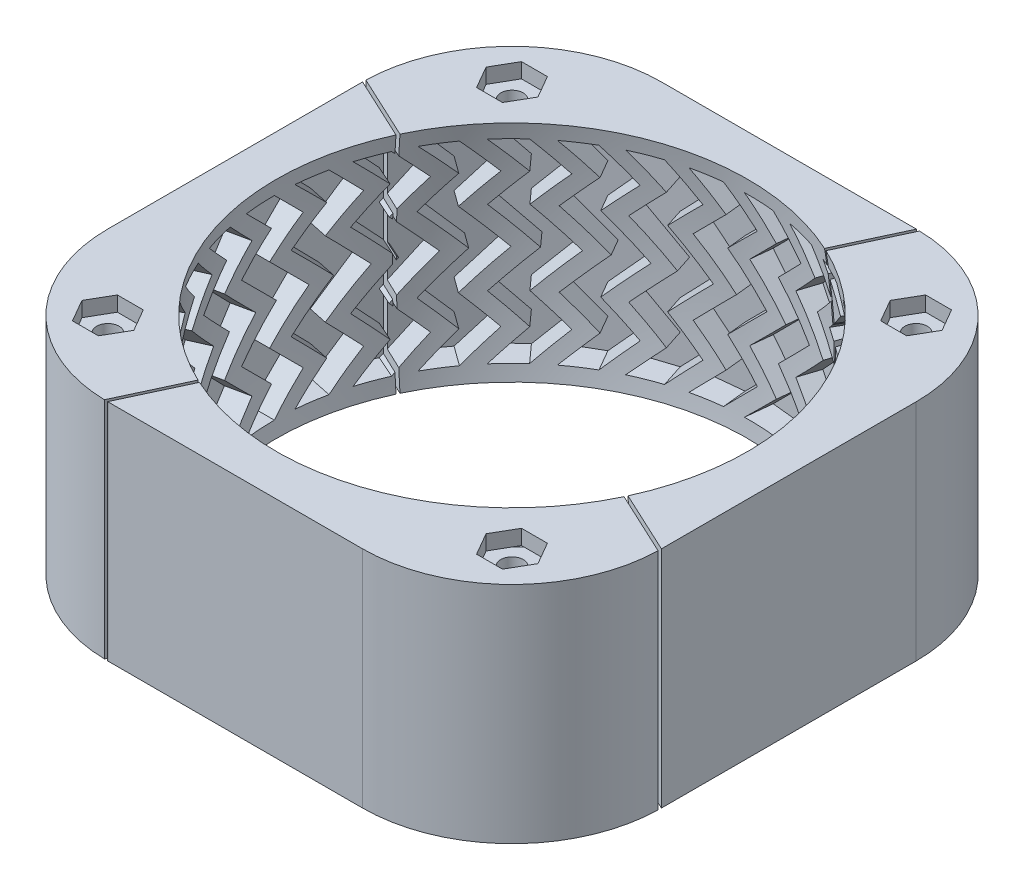
from build123d import *

# Parameters (mm, degrees)
SKETCH_2_W               = 74
SKETCH_2_H               = 74
EXTRUDE_1_DEPTH          = 30
SKETCH_3_W               = 31.5
SKETCH_3_H               = 30
FILLET_1_R               = 20
CUT_EXTRUDE_3_DEPTH      = 4
PATTERN_CIRCULAR_1_COUNT = 30
SKETCH_17_R              = 1.5
CUT_EXTRUDE_12_DEPTH     = 61.31583545
CUT_EXTRUDE_13_DEPTH     = 2
CUT_EXTRUDE_15_DEPTH     = 2
CUT_EXTRUDE_16_DEPTH     = 61.31583545


with BuildPart() as part:
    # Эскиз2 → Бобышка-Вытянуть1 (new body)
    with BuildSketch(Plane(origin=(0, 0, 0), x_dir=(1, 0, 0), z_dir=(0, 1, 0))):
        Rectangle(SKETCH_2_W, SKETCH_2_H)
    extrude(amount=EXTRUDE_1_DEPTH)

    # Эскиз3 → Вырез-Повернуть1 (revolve, cut)
    with BuildSketch(Plane(origin=(0, 0, 0), x_dir=(0, 0, -1), z_dir=(1, 0, 0))):
        with BuildLine():
            Line((-31.5, 0), (-31.5, 30))
            ThreePointArc((-31.5, 30), (-32.5, 15), (-31.5, 0))
        make_face()
        with Locations((-15.75, 15)):
            Rectangle(SKETCH_3_W, SKETCH_3_H)
    revolve(axis=Axis((0, 41.352219932, 0), (0, -1, 0)), mode=Mode.SUBTRACT)

    # Скругление1
    fillet_1_edges = [part.edges().sort_by_distance(p)[0] for p in [
        (-37, 15, -37),
        (37, 15, -37),
        (37, 15, 37),
        (-37, 15, 37),
    ]]
    fillet(fillet_1_edges, radius=FILLET_1_R)

    # Эскиз7 → Вырез-Вытянуть3 (cut)
    with BuildSketch(Plane(origin=(31, 0, 0), x_dir=(0, 0, -1), z_dir=(1, 0, 0))):
        Polygon((-1, 15), (4, 20), (0, 24), (4, 28), (0, 28), (-4, 24), (0, 20), (-5, 15), (0, 10), (-4, 6), (0, 2), (4, 2), (0, 6), (4, 10), align=None)
    cut_extrude_3 = extrude(amount=CUT_EXTRUDE_3_DEPTH, mode=Mode.SUBTRACT)

    # Круговой массив1: Вырез-Вытянуть3 ×30 about axis
    pattern_circular_1_axis = Axis((0, 0, 0), (0, 1, 0))
    for i in range(1, PATTERN_CIRCULAR_1_COUNT):
        add(cut_extrude_3.rotate(pattern_circular_1_axis, i * 360 / PATTERN_CIRCULAR_1_COUNT), mode=Mode.SUBTRACT)

    # Эскиз17 → Вырез-Вытянуть12 (cut, through all)
    with BuildSketch(Plane(origin=(0, 0, 0), x_dir=(1, 0, 0), z_dir=(0, 1, 0))):
        with Locations(Location((-27, 27, 0), (0, 0, 270))):
            Circle(SKETCH_17_R)
        with Locations(Location((27, 27, 0), (0, 0, 270))):
            Circle(SKETCH_17_R)
        with Locations(Location((27, -27, 0), (0, 0, 270))):
            Circle(SKETCH_17_R)
        with Locations(Location((-27, -27, 0), (0, 0, 270))):
            Circle(SKETCH_17_R)
    extrude(amount=CUT_EXTRUDE_12_DEPTH, mode=Mode.SUBTRACT)

    # Эскиз18 → Вырез-Вытянуть13 (cut)
    with BuildSketch(Plane(origin=(0, 30, 0), x_dir=(1, 0, 0), z_dir=(0, 1, 0))):
        Polygon((-28.732050808, 30), (-30.464101615, 27), (-28.732050808, 24), (-25.267949192, 24), (-23.535898385, 27), (-25.267949192, 30), align=None)
        Polygon((25.267949192, 30), (23.535898385, 27), (25.267949192, 24), (28.732050808, 24), (30.464101615, 27), (28.732050808, 30), align=None)
        Polygon((25.267949192, -24), (23.535898385, -27), (25.267949192, -30), (28.732050808, -30), (30.464101615, -27), (28.732050808, -24), align=None)
        Polygon((-28.732050808, -24), (-30.464101615, -27), (-28.732050808, -30), (-25.267949192, -30), (-23.535898385, -27), (-25.267949192, -24), align=None)
    extrude(amount=-CUT_EXTRUDE_13_DEPTH, mode=Mode.SUBTRACT)

    # Эскиз19 → Вырез-Вытянуть15 (cut)
    with BuildSketch(Plane(origin=(0, 0, 0), x_dir=(1, 0, 0), z_dir=(0, 1, 0))):
        Polygon((-28.732050808, -30), (-25.267949192, -30), (-23.535898385, -27), (-25.267949192, -24), (-28.732050808, -24), (-30.464101615, -27), align=None)
        Polygon((25.267949192, -30), (28.732050808, -30), (30.464101615, -27), (28.732050808, -24), (25.267949192, -24), (23.535898385, -27), align=None)
        Polygon((25.267949192, 24), (28.732050808, 24), (30.464101615, 27), (28.732050808, 30), (25.267949192, 30), (23.535898385, 27), align=None)
        Polygon((-28.732050808, 24), (-25.267949192, 24), (-23.535898385, 27), (-25.267949192, 30), (-28.732050808, 30), (-30.464101615, 27), align=None)
    extrude(amount=CUT_EXTRUDE_15_DEPTH, mode=Mode.SUBTRACT)

    # Эскиз20 → Вырез-Вытянуть16 (cut, through all)
    with BuildSketch(Plane(origin=(0, 0, 0), x_dir=(1, 0, 0), z_dir=(0, 1, 0))):
        Polygon((-17.108944173, -37.163489497), (-17.471467287, -36.994442193), (17.108944173, 37.163489497), (17.471467287, 36.994442193), align=None)
        Polygon((-37.163489497, 17.108944173), (36.994442193, -17.471467287), (37.163489497, -17.108944173), (-36.994442193, 17.471467287), align=None)
    extrude(amount=CUT_EXTRUDE_16_DEPTH, mode=Mode.SUBTRACT)


with BuildPart() as cut_extrude_16_piece_1:
    # of the separate pieces the step leaves, piece 1, a body of its own (cut_extrude_16_pieces)
    add(part.part.solids().sort_by_distance((17, 0, 37))[0])


with BuildPart() as cut_extrude_16_piece_2:
    # of the separate pieces the step leaves, piece 2, a body of its own (cut_extrude_16_pieces)
    add(part.part.solids().sort_by_distance((13.130945356, 0, -28.632643505))[0])


with BuildPart() as cut_extrude_16_piece_3:
    # of the separate pieces the step leaves, piece 3, a body of its own (cut_extrude_16_pieces)
    add(part.part.solids().sort_by_distance((-17.471467287, 0, 36.994442193))[0])


with BuildPart() as cut_extrude_16_piece_4:
    # of the separate pieces the step leaves, piece 4, a body of its own (cut_extrude_16_pieces)
    add(part.part.solids().sort_by_distance((36.999973275, 0, 17.032695306))[0])


solid = Compound([cut_extrude_16_piece_1.part, cut_extrude_16_piece_2.part, cut_extrude_16_piece_3.part, cut_extrude_16_piece_4.part])
